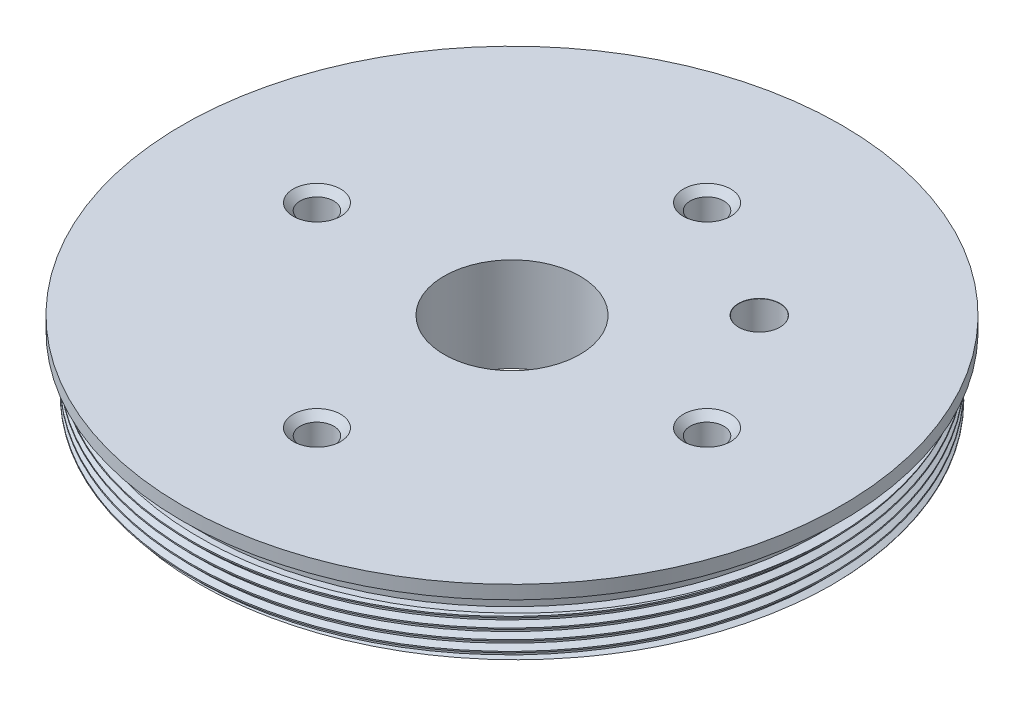
from build123d import *

# Parameters (mm, degrees)
THREAD2_PITCH                        = 1.5
CIRPATTERN1_COUNT                    = 4
F_6_1_6_1_DIAMETER_HOLE1_D           = 6.1
F_6_1_6_1_DIAMETER_HOLE1_CSINK_D     = 6.15
F_6_1_6_1_DIAMETER_HOLE1_CSINK_ANGLE = 90
SKETCH37_R                           = 75.495296565
SKETCH37_R_2                         = 42.86
CUT_EXTRUDE3_DEPTH                   = 3


with BuildPart() as part:
    # Sketch1 → Revolve1 (revolve)
    with BuildSketch(Plane.XY, mode=Mode.PRIVATE) as revolve1_sk:
        Polygon((-10.1, 14), (-10.1, 0), (-47.5, 0), (-47.5, 9), (-46, 9), (-46, 12), (-49, 12), (-49, 14), align=None)
    revolve(revolve1_sk.sketch.rotate(Axis((0, 0, 0), (0, 1, 0)), 270), axis=Axis((0, 0, 0), (0, 1, 0)))

    # Thread2: the profile of Thread Profile2 profile screwed along a right-hand helix of 6 turns, 8 arcs to a turn; built about Z, then put on its axis
    thread2_z = Axis((0, 0, 0), (0, 0, 1))
    thread2_corners = [(47.5003, 0, -0.000173205), (47.5003, 0, 1.312673201), (46.688101188, 0, 0.843749998), (46.688101188, 0, 0.468749998)]
    with BuildLine(mode=Mode.PRIVATE) as thread2_profile:
        Line(thread2_corners[0], thread2_corners[1])
        Line(thread2_corners[1], thread2_corners[2])
        Line(thread2_corners[2], thread2_corners[3])
        Line(thread2_corners[3], thread2_corners[0])
    thread2_cap = Face(thread2_profile.wire())
    thread2_turn_angles = [0, 22.5, 45, 67.5, 90, 112.5, 135, 157.5, 180, 202.5, 225, 247.5, 270, 292.5, 315, 337.5, 360]
    thread2_turn_weights = [1, 0.9238795325112867, 1, 0.9238795325112867, 1, 0.9238795325112867, 1, 0.9238795325112867, 1, 0.9238795325112867, 1, 0.9238795325112867, 1, 0.9238795325112867, 1, 0.9238795325112867, 1]
    thread2_turn_rails = [Edge.make_bspline([Vector(p[0], p[1], 0).rotate(thread2_z, thread2_turn_angles[k]) / thread2_turn_weights[k] + Vector(0, 0, p[2] + THREAD2_PITCH * thread2_turn_angles[k] / 360) for k in range(17)], [0, 0, 0, 1, 1, 2, 2, 3, 3, 4, 4, 5, 5, 6, 6, 7, 7, 8, 8, 8], 2, thread2_turn_weights) for p in thread2_corners]
    thread2_turn_sides = [Face.make_surface_from_curves(thread2_turn_rails[p[0]], thread2_turn_rails[p[1]]) for p in [(0, 1), (1, 2), (2, 3), (3, 0)]]
    thread2 = Plane(origin=(0, 0, 0), x_dir=(1, 0, 0), z_dir=(0, 1, 0)) * Solid(Shell([*[p.moved(Location((0, 0, THREAD2_PITCH * i))) for i in range(6) for p in thread2_turn_sides], thread2_cap, thread2_cap.rotate(thread2_z, 2160).moved(Location((0, 0, THREAD2_PITCH * 2160 / 360)))]))
    add(thread2, mode=Mode.SUBTRACT)

    # Sketch32 → M6 Tapped Hole1 (revolve, cut)
    with BuildSketch(Plane(origin=(29, 14, 0), x_dir=(0, 0, 1), z_dir=(1, 0, 0))):
        Polygon((0, 0), (0, 9.502151548), (2.5, 8), (2.5, 1.025), (3.525, 0), align=None)
    m6_tapped_hole1 = revolve(axis=Axis((29, 20.35, 0), (0, -1, 0)), mode=Mode.SUBTRACT)

    # CirPattern1: M6 Tapped Hole1 ×4 about axis
    cirpattern1_axis = Axis((0, 0, 0), (0, 1, 0))
    for i in range(1, CIRPATTERN1_COUNT):
        add(m6_tapped_hole1.rotate(cirpattern1_axis, i * 360 / CIRPATTERN1_COUNT), mode=Mode.SUBTRACT)

    # Ø6.1 (6.1) Diameter Hole1 (through all)
    with Locations(Plane(origin=(0, 14, 0), x_dir=(1, 0, 0), z_dir=(0, 1, 0))):
        with Locations((18.384776311, 18.384776311)):
            CounterSinkHole(F_6_1_6_1_DIAMETER_HOLE1_D / 2, F_6_1_6_1_DIAMETER_HOLE1_CSINK_D / 2, counter_sink_angle=F_6_1_6_1_DIAMETER_HOLE1_CSINK_ANGLE)

    # Sketch37 → Cut-Extrude3 (cut)
    with BuildSketch(Plane.XZ):
        Circle(SKETCH37_R)
        with Locations(Location((0, 0, 0), (0, 0, 270))):
            Circle(SKETCH37_R_2, mode=Mode.SUBTRACT)
    extrude(amount=-CUT_EXTRUDE3_DEPTH, mode=Mode.SUBTRACT)


solid = part.part
